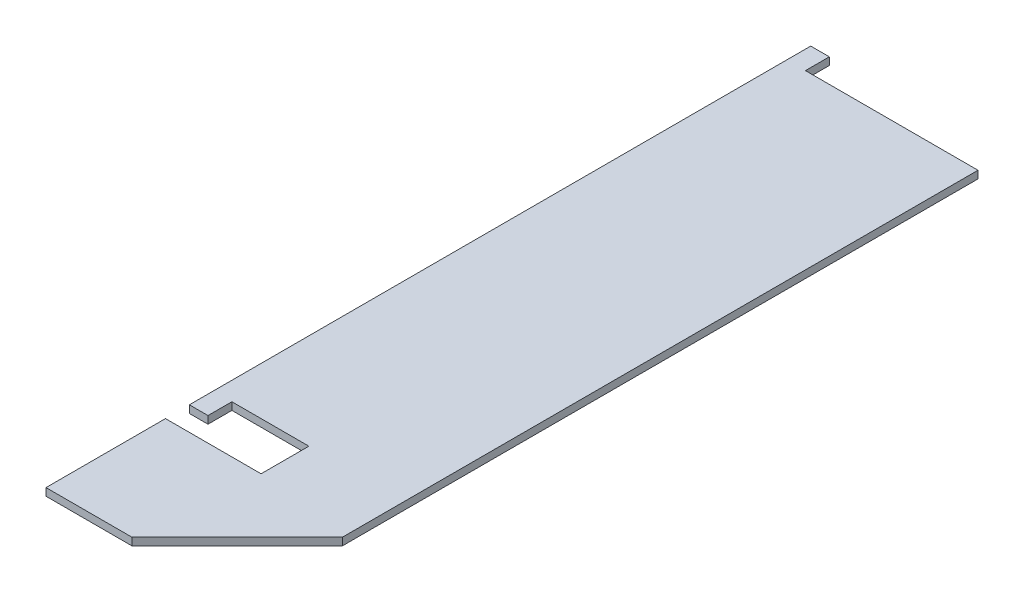
from build123d import *

# Parameters (mm, degrees)
BOSS_EXTRUDE1_DEPTH = 1.00076
SKETCH2_W           = 2.472118206
SKETCH2_H           = 1.00076
BOSS_EXTRUDE2_DEPTH = 3.175
CHAMFER2_SIZE       = 13.97


with BuildPart() as part:
    # Sketch1 → Boss-Extrude1 (new body)
    with BuildSketch(Plane(origin=(0, 0, 0), x_dir=(1, 0, 0), z_dir=(0, 1, 0))):
        Polygon((0, -38.1), (0, -44.45), (-12.7, -44.45), (-12.7, -60.325), (12.7, -60.325), (12.7, -38.1), (12.7, 38.1), (-12.7, 38.1), (-12.7, -38.1), align=None)
    extrude(amount=BOSS_EXTRUDE1_DEPTH)

    # Sketch2 → Boss-Extrude2 (add)
    with BuildSketch(Plane.XY.offset(38.1)):
        with Locations((-11.463940897, 0.50038)):
            Rectangle(SKETCH2_W, SKETCH2_H)
    boss_extrude2 = extrude(amount=BOSS_EXTRUDE2_DEPTH)

    # Mirror1: Boss-Extrude2 across plane
    add(boss_extrude2.mirror(Plane.XY))

    # Chamfer2
    chamfer2_edges = [part.edges().sort_by_distance(p)[0] for p in [
        (12.7, 0.50038, 60.325),
    ]]
    chamfer(chamfer2_edges, length=CHAMFER2_SIZE)


solid = part.part
